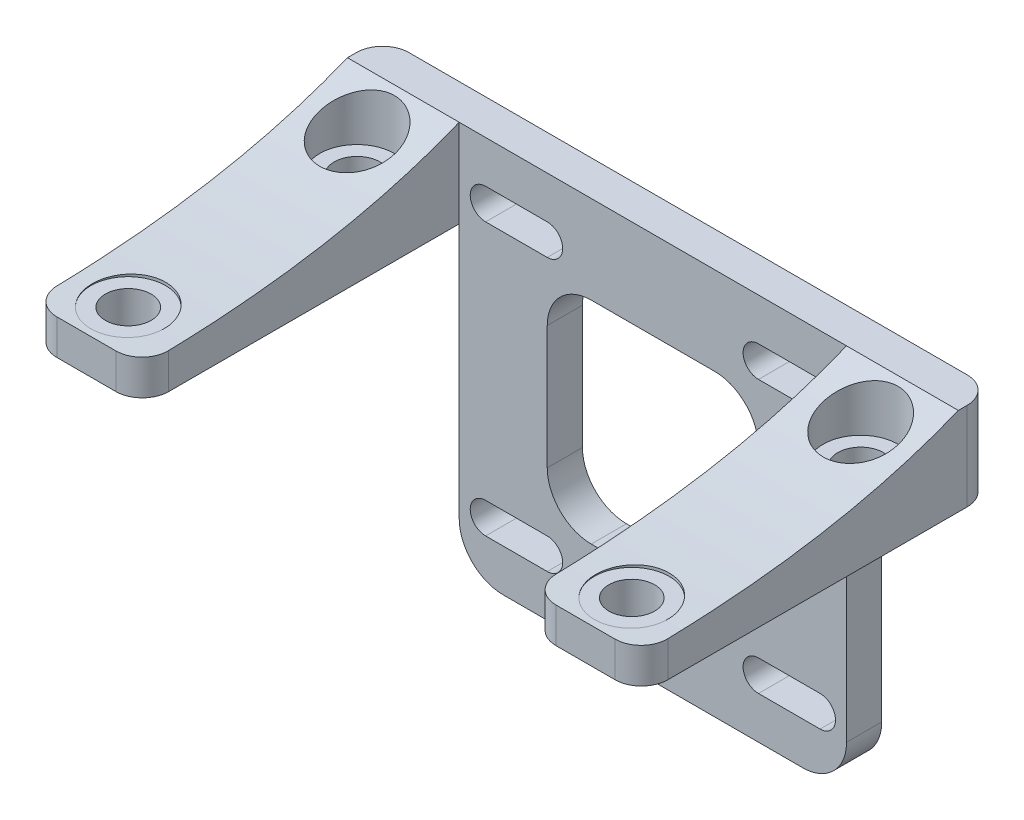
from build123d import *

# Parameters (mm, degrees)
SKETCH1_W           = 44
SKETCH1_H           = 44
BOSS_EXTRUDE1_DEPTH = 4
BOSS_EXTRUDE2_DEPTH = 12.7
SKETCH3_R           = 2.6
CUT_EXTRUDE1_DEPTH  = 63.929246102
SKETCH4_R           = 4.25
CUT_EXTRUDE2_DEPTH  = 66.177373489
FILLET1_R           = 3
FILLET2_R           = 5


with BuildPart() as part:
    # Sketch1 → Boss-Extrude1 (new body)
    with BuildSketch(Plane.XY):
        Rectangle(SKETCH1_W, SKETCH1_H)
        with BuildLine():
            Line((7, 12), (-7, 12))
            ThreePointArc((-7, 12), (-10.535533906, 10.535533906), (-12, 7))
            Line((-12, 7), (-12, -7))
            ThreePointArc((-12, -7), (-10.535533906, -10.535533906), (-7, -12))
            Line((-7, -12), (7, -12))
            ThreePointArc((7, -12), (10.535533906, -10.535533906), (12, -7))
            Line((12, -7), (12, 7))
            ThreePointArc((12, 7), (10.535533906, 10.535533906), (7, 12))
        make_face(mode=Mode.SUBTRACT)
        with BuildLine():
            Line((-19, 17.2), (-12, 17.2))
            ThreePointArc((-12, 17.2), (-10.25, 15.45), (-12, 13.7))
            Line((-12, 13.7), (-19, 13.7))
            ThreePointArc((-19, 13.7), (-20.75, 15.45), (-19, 17.2))
        make_face(mode=Mode.SUBTRACT)
        with BuildLine():
            Line((-19, -17.2), (-12, -17.2))
            ThreePointArc((-12, -17.2), (-10.25, -15.45), (-12, -13.7))
            Line((-12, -13.7), (-19, -13.7))
            ThreePointArc((-19, -13.7), (-20.75, -15.45), (-19, -17.2))
        make_face(mode=Mode.SUBTRACT)
        with BuildLine():
            Line((12, 17.2), (19, 17.2))
            ThreePointArc((19, 17.2), (20.75, 15.45), (19, 13.7))
            Line((19, 13.7), (12, 13.7))
            ThreePointArc((12, 13.7), (10.25, 15.45), (12, 17.2))
        make_face(mode=Mode.SUBTRACT)
        with BuildLine():
            Line((12, -13.7), (19, -13.7))
            ThreePointArc((19, -13.7), (20.75, -15.45), (19, -17.2))
            Line((19, -17.2), (12, -17.2))
            ThreePointArc((12, -17.2), (10.25, -15.45), (12, -13.7))
        make_face(mode=Mode.SUBTRACT)
    extrude(amount=BOSS_EXTRUDE1_DEPTH)

    # Sketch2 → Boss-Extrude2 (add)
    with BuildSketch(Plane(origin=(22, 0, 0), x_dir=(0, 0, -1), z_dir=(1, 0, 0))):
        with BuildLine():
            Line((0, 12), (-40, 12))
            Line((-40, 12), (-40, 16))
            add(Edge.make_bspline(
                [(-40, 16), (-18.32972451, 16.119369884), (-4, 22)],
                knots=[0, 0, 0, 1, 1, 1], degree=2))
            Line((-4, 22), (0, 22))
            Line((0, 22), (0, 12))
        make_face()
    boss_extrude2 = extrude(amount=BOSS_EXTRUDE2_DEPTH)

    # Sketch3 → Cut-Extrude1 (cut, through all)
    with BuildSketch(Plane.XZ.offset(-12)):
        with Locations((28.6, 35)):
            Circle(SKETCH3_R)
        with Locations((28.6, 9)):
            Circle(SKETCH3_R)
    cut_extrude1 = extrude(amount=-CUT_EXTRUDE1_DEPTH, mode=Mode.SUBTRACT)

    # Sketch4 → Cut-Extrude2 (cut, through all)
    with BuildSketch(Plane(origin=(0, 16, 0), x_dir=(-1, 0, 0), z_dir=(0, -1, 0))):
        with Locations((-28.6, -9)):
            Circle(SKETCH4_R)
        with Locations((-28.6, -35)):
            Circle(SKETCH4_R)
    cut_extrude2 = extrude(amount=-CUT_EXTRUDE2_DEPTH, mode=Mode.SUBTRACT)

    # Mirror1: Boss-Extrude2, Cut-Extrude1, Cut-Extrude2 across plane
    add(boss_extrude2.mirror(Plane(origin=(0, 0, 0), x_dir=(0, 0, 1), z_dir=(1, 0, 0))))
    add(cut_extrude1.mirror(Plane(origin=(0, 0, 0), x_dir=(0, 0, 1), z_dir=(1, 0, 0))), mode=Mode.SUBTRACT)
    add(cut_extrude2.mirror(Plane(origin=(0, 0, 0), x_dir=(0, 0, 1), z_dir=(1, 0, 0))), mode=Mode.SUBTRACT)

    # Fillet1
    fillet1_edges = [part.edges().sort_by_distance(p)[0] for p in [
        (34.7, 17, 0),
        (-34.7, 17, 0),
        (34.7, 14, 40),
        (22, 14, 40),
        (-22, 14, 40),
        (-34.7, 14, 40),
    ]]
    fillet(fillet1_edges, radius=FILLET1_R)

    # Fillet2
    fillet2_edges = [part.edges().sort_by_distance(p)[0] for p in [
        (22, -22, 2),
        (-22, -22, 2),
    ]]
    fillet(fillet2_edges, radius=FILLET2_R)


solid = part.part
